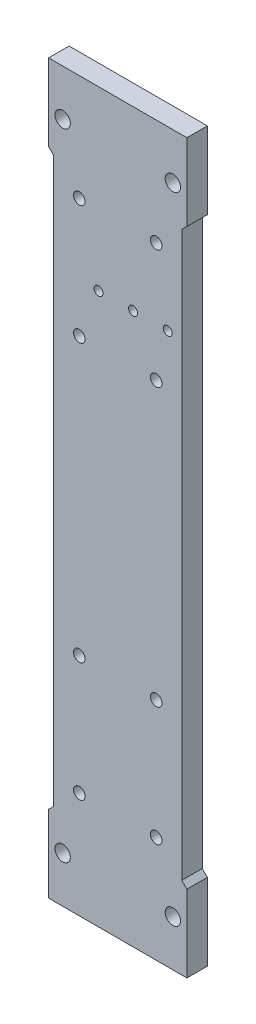
from build123d import *

# Parameters (mm, degrees)
ESQUISSE1_W             = 50
ESQUISSE1_H             = 284
BOSS_EXTRU_1_DEPTH      = 8
ESQUISSE2_R             = 3
ENL_V_MAT_EXTRU_1_DEPTH = 289.478768716
ESQUISSE3_W             = 2
ESQUISSE3_H             = 30
BOSS_EXTRU_2_DEPTH      = 8
CHANFREIN1_SIZE         = 2
ESQUISSE4_R             = 2.25
ENL_V_MAT_EXTRU_2_DEPTH = 289.832131177
ESQUISSE5_R             = 1.75
ENL_V_MAT_EXTRU_3_DEPTH = 289.832131177


with BuildPart() as part:
    # Esquisse1 → Boss.-Extru.1 (new body)
    with BuildSketch(Plane.XY):
        with Locations((25, 142)):
            Rectangle(ESQUISSE1_W, ESQUISSE1_H)
    extrude(amount=BOSS_EXTRU_1_DEPTH)

    # Esquisse2 → Enlèv. mat.-Extru.1 (cut, through all)
    with BuildSketch(Plane.XY.offset(8)):
        with Locations((3.5, 18)):
            Circle(ESQUISSE2_R)
        with Locations(Location((46.5, 18, 0), (0, 0, 180))):
            Circle(ESQUISSE2_R)
        with Locations((46.5, 266)):
            Circle(ESQUISSE2_R)
        with Locations(Location((3.5, 266, 0), (0, 0, 180))):
            Circle(ESQUISSE2_R)
    extrude(amount=-ENL_V_MAT_EXTRU_1_DEPTH, mode=Mode.SUBTRACT)

    # Esquisse3 → Boss.-Extru.2 (add)
    with BuildSketch(Plane.XY.offset(8)):
        with Locations((-1, 15)):
            Rectangle(ESQUISSE3_W, ESQUISSE3_H)
        with Locations((51, 15)):
            Rectangle(ESQUISSE3_W, ESQUISSE3_H)
        with Locations((51, 269)):
            Rectangle(ESQUISSE3_W, ESQUISSE3_H)
        with Locations((-1, 269)):
            Rectangle(ESQUISSE3_W, ESQUISSE3_H)
    extrude(amount=-BOSS_EXTRU_2_DEPTH)

    # Chanfrein1
    chanfrein1_edges = [part.edges().sort_by_distance(p)[0] for p in [
        (50, 30, 4),
        (0, 30, 4),
        (0, 254, 4),
        (50, 254, 4),
    ]]
    chamfer(chanfrein1_edges, length=CHANFREIN1_SIZE - 0.0001)  # a hair under: the kernel refuses the full size

    # Esquisse4 → Enlèv. mat.-Extru.2 (cut, through all)
    with BuildSketch(Plane.XY.offset(8)):
        with Locations((10, 41.5)):
            Circle(ESQUISSE4_R)
        with Locations((10, 88)):
            Circle(ESQUISSE4_R)
        with Locations(Location((40, 88, 0), (0, 0, 180))):
            Circle(ESQUISSE4_R)
        with Locations(Location((40, 41.5, 0), (0, 0, 180))):
            Circle(ESQUISSE4_R)
        with Locations((40, 242.5)):
            Circle(ESQUISSE4_R)
        with Locations((40, 196)):
            Circle(ESQUISSE4_R)
        with Locations(Location((10, 196, 0), (0, 0, 180))):
            Circle(ESQUISSE4_R)
        with Locations(Location((10, 242.5, 0), (0, 0, 180))):
            Circle(ESQUISSE4_R)
    extrude(amount=-ENL_V_MAT_EXTRU_2_DEPTH, mode=Mode.SUBTRACT)

    # Esquisse5 → Enlèv. mat.-Extru.3 (cut, through all)
    with BuildSketch(Plane.XY.offset(8)):
        with Locations((44.5, 215)):
            Circle(ESQUISSE5_R)
        with Locations((31, 215)):
            Circle(ESQUISSE5_R)
        with Locations(Location((17.5, 215, 0), (0, 0, 180))):
            Circle(ESQUISSE5_R)
    extrude(amount=-ENL_V_MAT_EXTRU_3_DEPTH, mode=Mode.SUBTRACT)


solid = part.part
